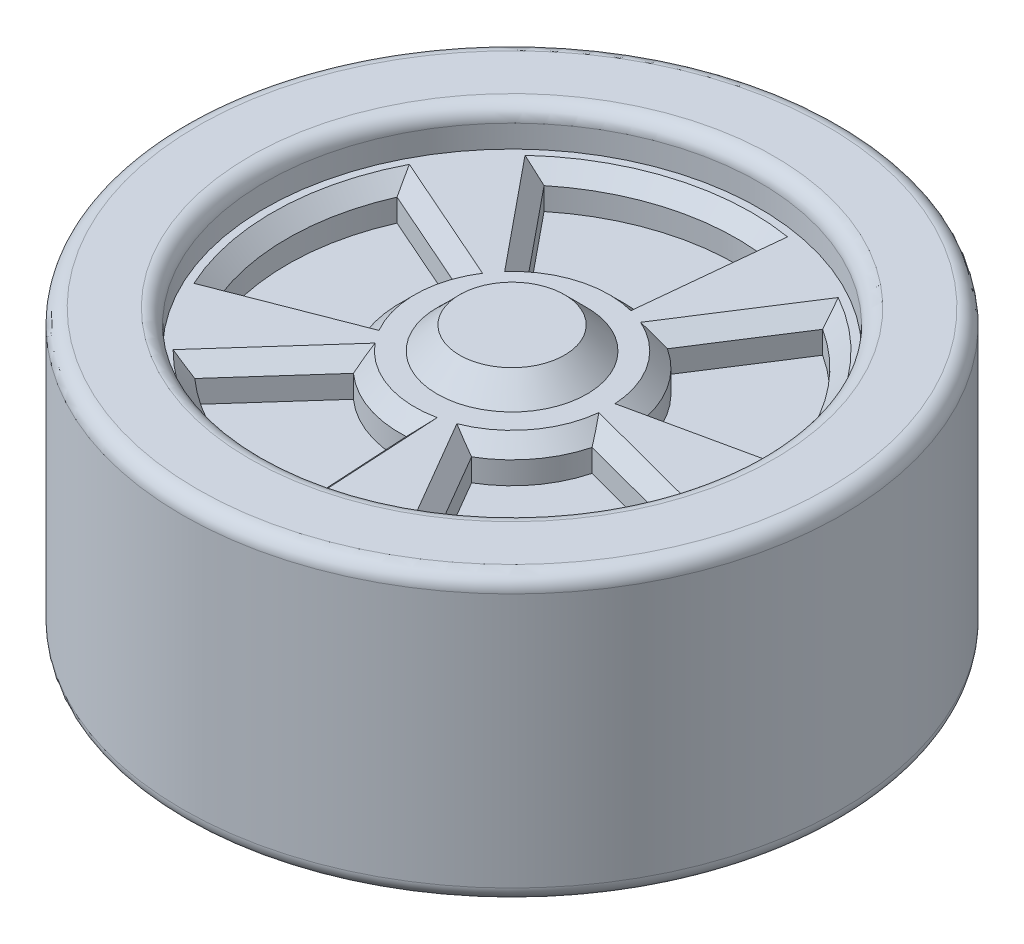
from build123d import *

# Parameters (mm, degrees)
SKETCH_1_R          = 44
EXTRUDE_1_DEPTH     = 38
SKETCH_3_R          = 33
CUT_EXTRUDE_1_DEPTH = 5
CUT_EXTRUDE_2_DEPTH = 5
SKETCH_5_R          = 10
EXTRUDE_2_DEPTH     = 3
CHAMFER_1_SIZE      = 3
CHAMFER_2_SIZE      = 2
FILLET_1_R          = 2
CUT_EXTRUDE_START   = -2.92
SKETCH_6_R          = 33
SKETCH_6_R_2        = 7.5
SKETCH_6_R_3        = 3
CUT_EXTRUDE_3_DEPTH = 2.92


with BuildPart() as part:
    # 草图1 → 凸台-拉伸1 (new body)
    with BuildSketch(Plane(origin=(0, 0, 0), x_dir=(1, 0, 0), z_dir=(0, 1, 0))):
        with Locations(Location((0, 0, 0), (0, 0, 270))):
            Circle(SKETCH_1_R)
    extrude(amount=EXTRUDE_1_DEPTH)

    # 草图3 → 切除-拉伸1 (cut)
    with BuildSketch(Plane(origin=(0, 38, 0), x_dir=(1, 0, 0), z_dir=(0, 1, 0))):
        with Locations(Location((0, 0, 0), (0, 0, 270))):
            Circle(SKETCH_3_R)
    extrude(amount=-CUT_EXTRUDE_1_DEPTH, mode=Mode.SUBTRACT)

    # 草图4 → 切除-拉伸2 (cut)
    with BuildSketch(Plane(origin=(0, 33, 0), x_dir=(1, 0, 0), z_dir=(0, 1, 0))):
        with BuildLine():
            Line((-18.971630185, 23.239562132), (-9.485815093, 11.619781066))
            ThreePointArc((-9.485815093, 11.619781066), (-4.317052712, 14.365342178), (1.508941811, 14.923910165))
            Line((1.508941811, 14.923910165), (3.017883621, 29.84782033))
            ThreePointArc((3.017883621, 29.84782033), (-8.634105423, 28.730684356), (-18.971630185, 23.239562132))
        make_face()
        with BuildLine():
            Line((29.319541348, 6.353305844), (14.659770674, 3.176652922))
            ThreePointArc((14.659770674, 3.176652922), (12.328209633, 8.544895976), (8.119790432, 12.612256077))
            Line((8.119790432, 12.612256077), (16.239580864, 25.224512153))
            ThreePointArc((16.239580864, 25.224512153), (24.656419267, 17.089791951), (29.319541348, 6.353305844))
        make_face()
        with BuildLine():
            Line((15.102589466, -25.921261378), (7.551294733, -12.960630689))
            ThreePointArc((7.551294733, -12.960630689), (11.936305286, -9.084306035), (14.504121561, -3.824978136))
            Line((14.504121561, -3.824978136), (29.008243122, -7.649956272))
            ThreePointArc((29.008243122, -7.649956272), (23.872610571, -18.168612069), (15.102589466, -25.921261378))
        make_face()
        with BuildLine():
            Line((-19.98562774, -22.373526406), (-9.99281387, -11.186763203))
            ThreePointArc((-9.99281387, -11.186763203), (-4.951167267, -14.159305869), (0.84424967, -14.976222571))
            Line((0.84424967, -14.976222571), (1.68849934, -29.952445142))
            ThreePointArc((1.68849934, -29.952445142), (-9.902334534, -28.318611738), (-19.98562774, -22.373526406))
        make_face()
        with BuildLine():
            Line((-27.454386696, 12.09366161), (-13.727193348, 6.046830805))
            ThreePointArc((-13.727193348, 6.046830805), (-14.996294941, 0.33337375), (-13.98234657, -5.430836436))
            Line((-13.98234657, -5.430836436), (-27.96469314, -10.861672872))
            ThreePointArc((-27.96469314, -10.861672872), (-29.992589881, 0.666747501), (-27.454386696, 12.09366161))
        make_face()
    extrude(amount=-CUT_EXTRUDE_2_DEPTH, mode=Mode.SUBTRACT)

    # 草图5 → 凸台-拉伸2 (add)
    with BuildSketch(Plane(origin=(0, 33, 0), x_dir=(1, 0, 0), z_dir=(0, 1, 0))):
        with Locations(Location((0, 0, 0), (0, 0, 270))):
            Circle(SKETCH_5_R)
    extrude(amount=EXTRUDE_2_DEPTH)

    # 倒角1
    chamfer_1_edges = [part.edges().sort_by_distance(p)[0] for p in [
        (0, 36, -10),
    ]]
    chamfer(chamfer_1_edges, length=CHAMFER_1_SIZE - 0.0001)  # a hair under: the kernel refuses the full size

    # 倒角2
    chamfer_2_edges = [part.edges().sort_by_distance(p)[0] for p in [
        (-14.996294941, 33, -0.33337375),
        (-20.590790022, 33, -9.070246208),
        (-29.992589881, 33, -0.666747501),
        (-20.973519855, 33, 8.146254654),
        (-4.951167267, 33, 14.159305869),
        (-14.989220805, 33, 16.780144805),
        (-9.902334534, 33, 28.318611738),
        (1.266374505, 33, 22.464333856),
        (11.936305286, 33, 9.084306035),
        (11.3269421, 33, 19.440946033),
        (23.872610571, 33, 18.168612069),
        (21.756182342, 33, 5.737467204),
        (12.328209633, 33, -8.544895976),
        (21.989656011, 33, -4.764979383),
        (24.656419267, 33, -17.089791951),
        (12.179685648, 33, -18.918384115),
        (-4.317052712, 33, -14.365342178),
        (2.263412716, 33, -22.385865247),
        (-8.634105423, 33, -28.730684356),
        (-14.228722639, 33, -17.429671599),
    ]]
    chamfer(chamfer_2_edges, length=CHAMFER_2_SIZE)

    # 圆角1
    fillet_1_edges = [part.edges().sort_by_distance(p)[0] for p in [
        (0, 0, -44),
        (0, 38, -44),
        (0, 38, -33),
    ]]
    fillet(fillet_1_edges, radius=FILLET_1_R)

    # 草图6 → 切除-拉伸3 (cut)
    # profile 1 of 2: a face of its own
    with BuildSketch(Plane.XZ.offset(CUT_EXTRUDE_START)):
        with Locations(Location((0, 0, 0), (0, 0, 90))):
            Circle(SKETCH_6_R)
        with Locations(Location((0, 0, 0), (0, 0, 270))):
            Circle(SKETCH_6_R_2, mode=Mode.SUBTRACT)
    # profile 2 of 2: a face of its own
    with BuildSketch(Plane.XZ.offset(CUT_EXTRUDE_START)):
        with Locations(Location((0, 0, 0), (0, 0, 270))):
            Circle(SKETCH_6_R_3)
    extrude(amount=CUT_EXTRUDE_3_DEPTH, mode=Mode.SUBTRACT)


solid = part.part
